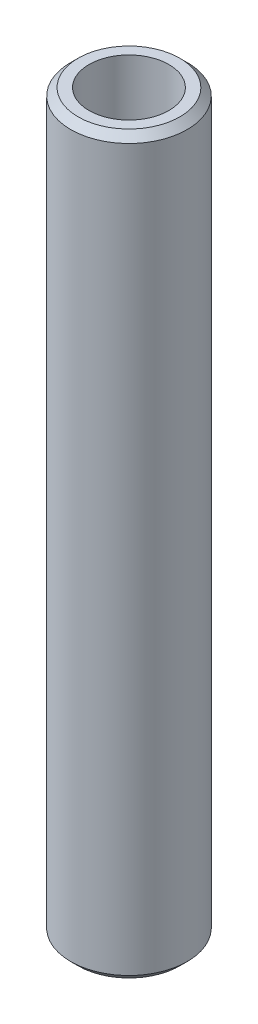
from build123d import *

# Parameters (mm, degrees)
SKETCH1_R           = 47.5
BOSS_EXTRUDE1_DEPTH = 600
SKETCH2_R           = 32.580718894
CUT_EXTRUDE1_DEPTH  = 604.748706003
CHAMFER1_SIZE       = 5.999417405


with BuildPart() as part:
    # Sketch1 → Boss-Extrude1 (new body)
    with BuildSketch(Plane(origin=(0, 0, 0), x_dir=(1, 0, 0), z_dir=(0, 1, 0))):
        Circle(SKETCH1_R)
    extrude(amount=BOSS_EXTRUDE1_DEPTH)

    # Sketch2 → Cut-Extrude1 (cut, through all)
    with BuildSketch(Plane(origin=(0, 0, 0), x_dir=(1, 0, 0), z_dir=(0, 1, 0))):
        Circle(SKETCH2_R)
    extrude(amount=CUT_EXTRUDE1_DEPTH, mode=Mode.SUBTRACT)

    # Chamfer1
    chamfer1_edges = [part.edges().sort_by_distance(p)[0] for p in [
        (-47.5, 600, 0),
        (-47.5, 0, 0),
    ]]
    chamfer(chamfer1_edges, length=CHAMFER1_SIZE)


solid = part.part
